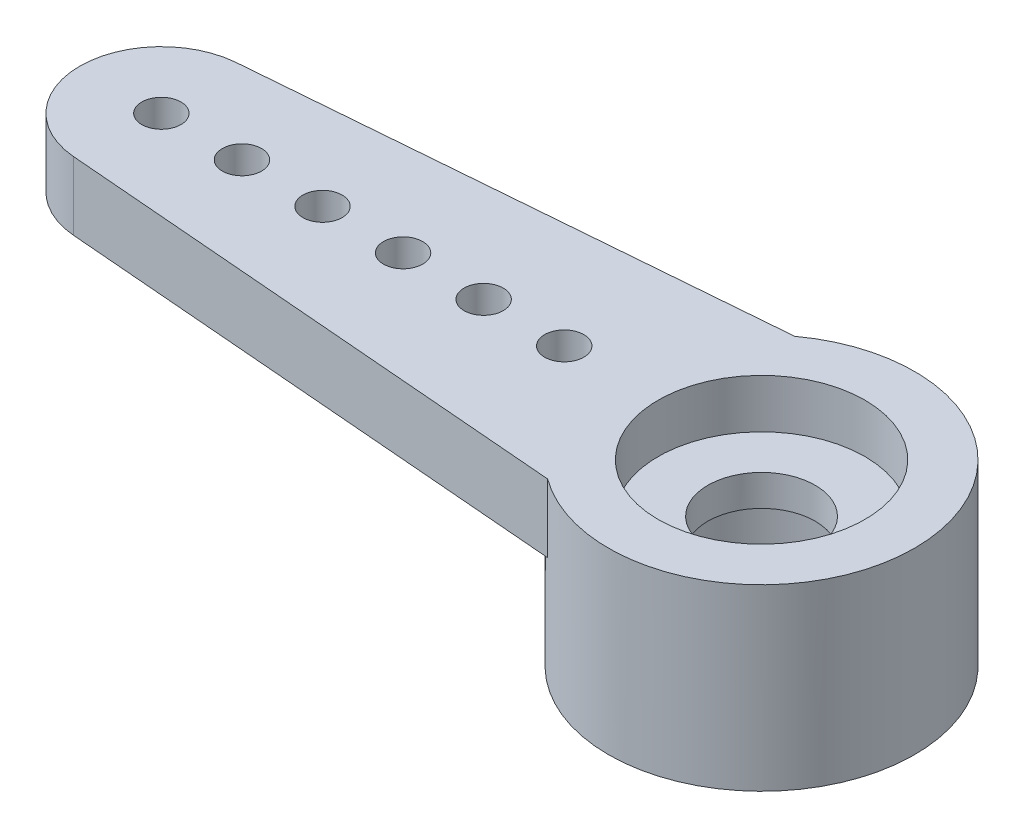
from build123d import *

# Parameters (mm, degrees)
EXTRUDE17_DEPTH = 1.6129
EXTRUDE19_START = -4.2291
SKETCH19_R      = 3.6195
EXTRUDE19_DEPTH = 4.2291
SKETCH20_R      = 0.46355
SKETCH20_R_2    = 1.27
EXTRUDE20_DEPTH = 18.054518091
SKETCH21_R      = 2.44475
EXTRUDE21_DEPTH = 1.1557
SKETCH22_R      = 2.286
EXTRUDE22_DEPTH = 2.3368


with BuildPart() as part:
    # Sketch18 → Extrude17 (new body)
    with BuildSketch(Plane(origin=(0, 0, 0), x_dir=(1, 0, 0), z_dir=(0, 1, 0))):
        with BuildLine():
            Line((-14.347205988, 1.923996328), (-2.13741415, 2.921))
            ThreePointArc((-2.13741415, 2.921), (3.6195, 0), (-2.13741415, -2.921))
            Line((-2.13741415, -2.921), (-14.347205988, -1.923996328))
            ThreePointArc((-14.347205988, -1.923996328), (-16.1205, 0), (-14.347205988, 1.923996328))
        make_face()
    extrude(amount=EXTRUDE17_DEPTH)

    # Sketch19 → Extrude19 (add)
    with BuildSketch(Plane(origin=(0, 1.6129, 0), x_dir=(1, 0, 0), z_dir=(0, 1, 0)).offset(EXTRUDE19_START)):
        Circle(SKETCH19_R)
    extrude(amount=EXTRUDE19_DEPTH)

    # Sketch20 → Extrude20 (cut, through all)
    with BuildSketch(Plane(origin=(0, 1.6129, 0), x_dir=(1, 0, 0), z_dir=(0, 1, 0))):
        with Locations((-14.1901, 0)):
            Circle(SKETCH20_R)
        Circle(SKETCH20_R_2)
        with Locations((-4.6651, 0)):
            Circle(SKETCH20_R)
        with Locations((-6.5701, 0)):
            Circle(SKETCH20_R)
        with Locations((-8.4751, 0)):
            Circle(SKETCH20_R)
        with Locations((-10.3801, 0)):
            Circle(SKETCH20_R)
        with Locations((-12.2851, 0)):
            Circle(SKETCH20_R)
    extrude(amount=-EXTRUDE20_DEPTH, mode=Mode.SUBTRACT)

    # Sketch21 → Extrude21 (cut)
    with BuildSketch(Plane(origin=(0, 1.6129, 0), x_dir=(1, 0, 0), z_dir=(0, 1, 0))):
        Circle(SKETCH21_R)
    extrude(amount=-EXTRUDE21_DEPTH, mode=Mode.SUBTRACT)

    # Sketch22 → Extrude22 (cut)
    with BuildSketch(Plane.XZ.offset(2.6162)):
        Circle(SKETCH22_R)
    extrude(amount=-EXTRUDE22_DEPTH, mode=Mode.SUBTRACT)


solid = part.part
